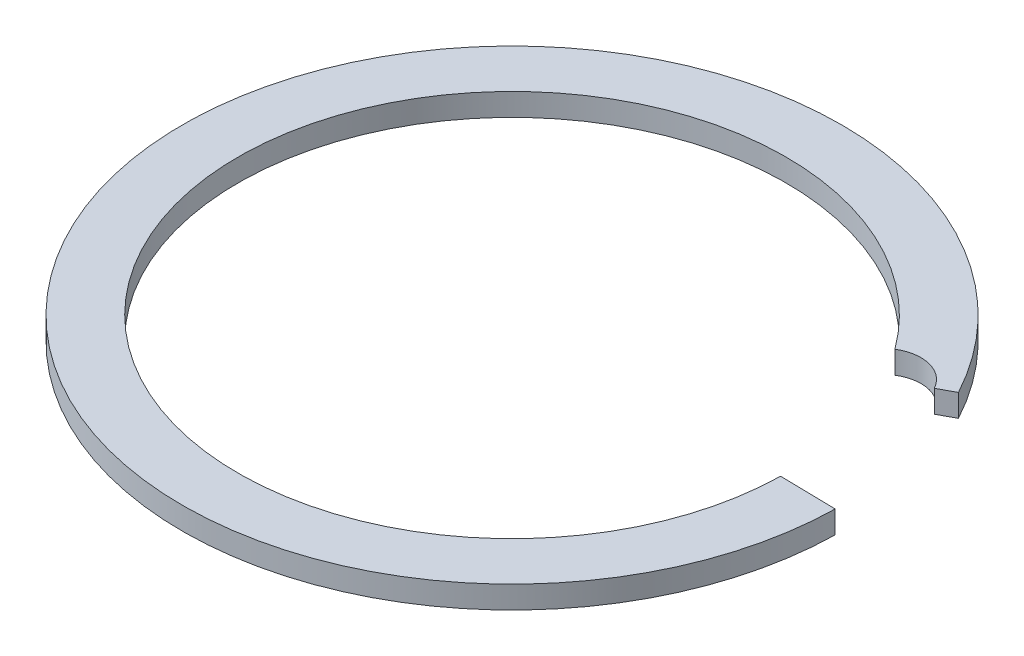
from build123d import *

# Parameters (mm, degrees)
EXTRUDE_THIN1_DEPTH = 0.46
SKETCH2_R           = 0.774944933
CUT_EXTRUDE1_DEPTH  = 10.557018363


with BuildPart() as part:
    # Sketch1 → Extrude-Thin1 (new body)
    with BuildSketch(Plane(origin=(0, 0, 0), x_dir=(1, 0, 0), z_dir=(0, 1, 0))):
        with BuildLine():
            ThreePointArc((4.940081659, 2.658513344), (-5.452907599, -1.318293867), (5.608956865, -0.108179869))
            Line((5.608956865, -0.108179869), (6.748744891, -0.130162944))
            ThreePointArc((6.748744891, -0.130162944), (-6.560985079, -1.58618246), (5.94394852, 3.198746002))
            Line((5.94394852, 3.198746002), (4.940081659, 2.658513344))
        make_face()
    extrude(amount=EXTRUDE_THIN1_DEPTH)

    # Sketch2 → Cut-Extrude1 (cut, through all)
    with BuildSketch(Plane(origin=(0, 0, 0), x_dir=(1, 0, 0), z_dir=(0, 1, 0))):
        with Locations((4.940081659, 2.658513344)):
            Circle(SKETCH2_R)
    extrude(amount=CUT_EXTRUDE1_DEPTH, mode=Mode.SUBTRACT)


solid = part.part
